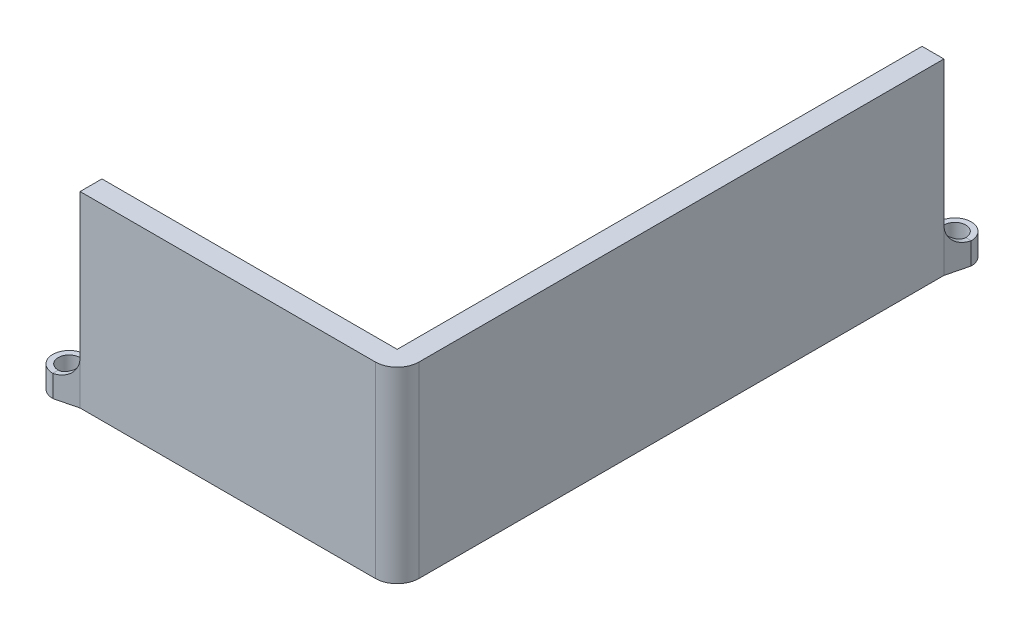
from build123d import *

# Parameters (mm, degrees)
SKETCH2_W           = 27
SKETCH2_H           = 17.15
BOSS_EXTRUDE1_DEPTH = 2
SKETCH3_W           = 48
SKETCH3_H           = 17.15
SKETCH3_W_2         = 2
BOSS_EXTRUDE2_DEPTH = 2
FILLET1_R           = 2
SKETCH4_R           = 1
BOSS_EXTRUDE3_DEPTH = 2
FILLET2_R           = 2


with BuildPart() as part:
    # Sketch2 → Boss-Extrude1 (new body)
    with BuildSketch(Plane.XY):
        with Locations((-0.118075802, 0.075)):
            Rectangle(SKETCH2_W, SKETCH2_H)
    extrude(amount=BOSS_EXTRUDE1_DEPTH)

    # Sketch3 → Boss-Extrude2 (add)
    with BuildSketch(Plane(origin=(13.381924198, 0, 0), x_dir=(0, 0, -1), z_dir=(1, 0, 0))):
        with Locations((24, 0.075)):
            Rectangle(SKETCH3_W, SKETCH3_H)
        with Locations((-1, 0.075)):
            Rectangle(SKETCH3_W_2, SKETCH3_H)
    extrude(amount=BOSS_EXTRUDE2_DEPTH)

    # Fillet1
    fillet1_edges = [part.edges().sort_by_distance(p)[0] for p in [
        (15.381924198, 0.075, 2),
    ]]
    fillet(fillet1_edges, radius=FILLET1_R)

    # Sketch4 → Boss-Extrude3 (add)
    # profile 1 of 4: a face of its own
    with BuildSketch(Plane.XZ.offset(8.5)):
        with BuildLine():
            Line((13.381924198, -48), (13.058394786, -49.294117647))
            ThreePointArc((13.058394786, -49.294117647), (14.381924198, -48.5), (15.70545361, -49.294117647))
            Line((15.70545361, -49.294117647), (15.381924198, -48))
            Line((15.381924198, -48), (13.381924198, -48))
        make_face()
    # profile 2 of 4: a face of its own
    with BuildSketch(Plane.XZ.offset(8.5)):
        with BuildLine():
            Line((13.058394786, -49.294117647), (12.881924198, -50))
            ThreePointArc((12.881924198, -50), (14.381924198, -51.5), (15.881924198, -50))
            Line((15.881924198, -50), (15.70545361, -49.294117647))
            ThreePointArc((15.70545361, -49.294117647), (14.381924198, -48.5), (13.058394786, -49.294117647))
        make_face()
        with Locations(Location((14.381924198, -50, 0), (0, 0, 270))):
            Circle(SKETCH4_R, mode=Mode.SUBTRACT)
    # profile 3 of 4: a face of its own
    with BuildSketch(Plane.XZ.offset(8.5)):
        with BuildLine():
            Line((-15.618075802, -0.5), (-14.912193449, -0.323529412))
            ThreePointArc((-14.912193449, -0.323529412), (-14.331836413, 0.228256367), (-14.118075802, 1))
            ThreePointArc((-14.118075802, 1), (-14.331836413, 1.771743633), (-14.912193449, 2.323529412))
            Line((-14.912193449, 2.323529412), (-15.618075802, 2.5))
            ThreePointArc((-15.618075802, 2.5), (-17.118075802, 1), (-15.618075802, -0.5))
        make_face()
        with Locations(Location((-15.618075802, 1, 0), (0, 0, 270))):
            Circle(SKETCH4_R, mode=Mode.SUBTRACT)
    # profile 4 of 4: a face of its own
    with BuildSketch(Plane.XZ.offset(8.5)):
        with BuildLine():
            Line((-14.912193449, -0.323529412), (-13.618075802, 0))
            Line((-13.618075802, 0), (-13.618075802, 2))
            Line((-13.618075802, 2), (-14.912193449, 2.323529412))
            ThreePointArc((-14.912193449, 2.323529412), (-14.331836413, 1.771743633), (-14.118075802, 1))
            ThreePointArc((-14.118075802, 1), (-14.331836413, 0.228256367), (-14.912193449, -0.323529412))
        make_face()
    extrude(amount=-BOSS_EXTRUDE3_DEPTH)

    # Fillet2
    # the kernel refuses this fillet: 2 mm, written as the material it adds along each edge
    with BuildSketch(Plane(origin=(-13.618075802, -6.5, -5), x_dir=(0, 1, 0), z_dir=(0, 0, 1))) as fillet2_piece_1_section:
        with BuildLine():
            CenterArc((FILLET2_R, FILLET2_R), FILLET2_R, 180, 90)
            Line((0, FILLET2_R), (0, 0))
            Line((0, 0), (FILLET2_R, 0))
        make_face()
    fillet2_piece_1 = extrude(amount=12, mode=Mode.PRIVATE)
    fillet2_piece_1 = split(fillet2_piece_1, bisect_by=Plane(origin=(-13.669858881, -6.170840666, 2.01294577), z_dir=(-0.24253562503633297, 0, -0.9701425001453319)), keep=Keep.TOP, mode=Mode.PRIVATE)
    fillet2_piece_1 = split(fillet2_piece_1, bisect_by=Plane(origin=(-14.177655248, -6.170840666, -0.139894862), z_dir=(-0.24253562503633314, 0, 0.9701425001453319)), keep=Keep.TOP, mode=Mode.PRIVATE)
    fillet2_piece_1 = fillet2_piece_1 - Plane(origin=(-15.618075802, -6.170840666, 1), x_dir=(0, 0, -1), z_dir=(0, -1, 0)) * Cylinder(1, 32, mode=Mode.PRIVATE)
    add(fillet2_piece_1)
    with BuildSketch(Plane(origin=(20.381924198, -6.5, -48), x_dir=(0, 1, 0), z_dir=(-1, 0, 0))) as fillet2_piece_2_section:
        with BuildLine():
            CenterArc((FILLET2_R, FILLET2_R), FILLET2_R, 180, 90)
            Line((0, FILLET2_R), (0, 0))
            Line((0, 0), (FILLET2_R, 0))
        make_face()
    fillet2_piece_2 = extrude(amount=12, mode=Mode.PRIVATE)
    fillet2_piece_2 = split(fillet2_piece_2, bisect_by=Plane(origin=(15.52181906, -6.170840666, -48.559579447), z_dir=(-0.9701425001453322, 0, -0.24253562503633172)), keep=Keep.TOP, mode=Mode.PRIVATE)
    fillet2_piece_2 = split(fillet2_piece_2, bisect_by=Plane(origin=(13.368978429, -6.170840666, -48.051783079), z_dir=(0.9701425001453319, 0, -0.24253562503633297)), keep=Keep.TOP, mode=Mode.PRIVATE)
    fillet2_piece_2 = fillet2_piece_2 - Plane(origin=(14.381924198, -6.170840666, -50), x_dir=(0, 0, -1), z_dir=(0, -1, 0)) * Cylinder(1, 32, mode=Mode.PRIVATE)
    add(fillet2_piece_2)


solid = part.part
